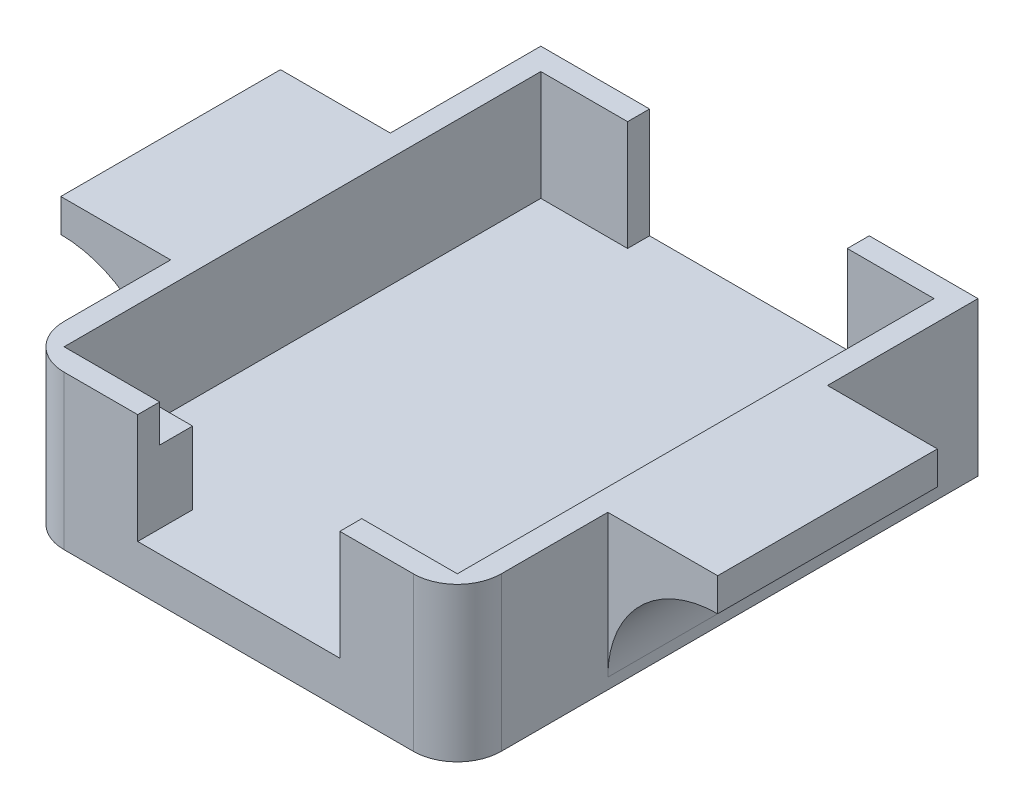
from build123d import *

# Parameters (mm, degrees)
SKETCH1_W               = 17.9
SKETCH1_H               = 21.7
BOSS_EXTRUDE1_DEPTH     = 2
BOSS_EXTRUDE2_OUTLINE_W = 19.9
BOSS_EXTRUDE2_OUTLINE_H = 23.7
BOSS_EXTRUDE2_DEPTH     = 7
SKETCH3_W               = 10
SKETCH3_H               = 5
CUT_EXTRUDE1_DEPTH      = 1
SKETCH4_W               = 9.2
SKETCH4_H               = 5
CUT_EXTRUDE2_DEPTH      = 1
SKETCH7_W               = 5
SKETCH7_H               = 10
BOSS_EXTRUDE3_DEPTH     = 1.5
FILLET1_R               = 5
SKETCH8_W               = 4.35
SKETCH8_H               = 1.5
CUT_EXTRUDE4_DEPTH      = 1.7
FILLET3_R               = 2


# Read off the part's stored shape, not the designer's step: Boss-Extrude2
with BuildPart() as part:
    # Sketch1 → Boss-Extrude1 (new body)
    with BuildSketch(Plane(origin=(0, 0, 0), x_dir=(1, 0, 0), z_dir=(0, 1, 0))):
        Rectangle(SKETCH1_W, SKETCH1_H)
    extrude(amount=BOSS_EXTRUDE1_DEPTH)

    # Boss-Extrude2 outline → Boss-Extrude2 (add)
    with BuildSketch(Plane(origin=(0, 0, 0), x_dir=(1, 0, 0), z_dir=(0, 1, 0))):
        Rectangle(BOSS_EXTRUDE2_OUTLINE_W, BOSS_EXTRUDE2_OUTLINE_H)
        Polygon((4.6, -9.35), (4.6, -10.85), (-4.6, -10.85), (-4.6, -9.35), (-8.95, -9.35), (-8.95, 10.85), (8.95, 10.85), (8.95, -9.35), align=None, mode=Mode.SUBTRACT)
    extrude(amount=BOSS_EXTRUDE2_DEPTH)

    # Sketch3 → Cut-Extrude1 (cut)
    with BuildSketch(Plane.XY.offset(-10.85)):
        with Locations((0, 4.5)):
            Rectangle(SKETCH3_W, SKETCH3_H)
    extrude(amount=-CUT_EXTRUDE1_DEPTH, mode=Mode.SUBTRACT)

    # Sketch4 → Cut-Extrude2 (cut)
    with BuildSketch(Plane.XY.offset(11.85)):
        with Locations((0, 4.5)):
            Rectangle(SKETCH4_W, SKETCH4_H)
    extrude(amount=-CUT_EXTRUDE2_DEPTH, mode=Mode.SUBTRACT)

    # Sketch7 → Boss-Extrude3 (add)
    with BuildSketch(Plane(origin=(0, 7, 0), x_dir=(1, 0, 0), z_dir=(0, 1, 0))):
        with Locations((-12.45, 0)):
            Rectangle(SKETCH7_W, SKETCH7_H)
        with Locations((12.45, 0)):
            Rectangle(SKETCH7_W, SKETCH7_H)
    extrude(amount=-BOSS_EXTRUDE3_DEPTH)

    # Fillet1
    fillet1_edges = [part.edges().sort_by_distance(p)[0] for p in [
        (9.95, 5.5, 0),
        (-9.95, 5.5, 0),
    ]]
    fillet(fillet1_edges, radius=FILLET1_R - 0.0001)  # a hair under: the kernel refuses the full size

    # Sketch8 → Cut-Extrude4 (cut)
    with BuildSketch(Plane(origin=(0, 7, 0), x_dir=(1, 0, 0), z_dir=(0, 1, 0))):
        with Locations((-6.775, -10.1)):
            Rectangle(SKETCH8_W, SKETCH8_H)
        with Locations((6.775, -10.1)):
            Rectangle(SKETCH8_W, SKETCH8_H)
    extrude(amount=-CUT_EXTRUDE4_DEPTH, mode=Mode.SUBTRACT)

    # Fillet3
    fillet3_edges = [part.edges().sort_by_distance(p)[0] for p in [
        (-9.95, 3.5, 11.85),
        (9.95, 3.5, 11.85),
    ]]
    fillet(fillet3_edges, radius=FILLET3_R)


solid = part.part
